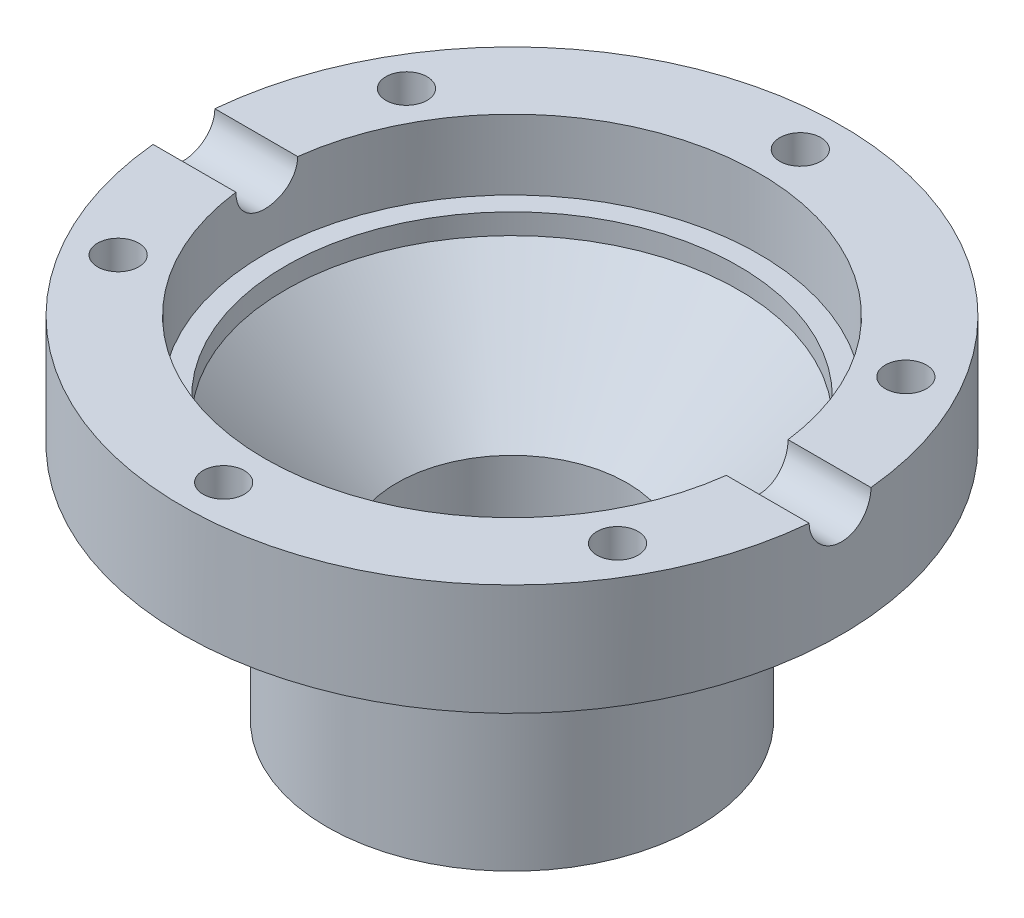
from build123d import *

# Parameters (mm, degrees)
SKETCH1_R           = 20.32
BOSS_EXTRUDE1_DEPTH = 21.59
SKETCH2_W           = 15.24
SKETCH2_H           = 4.318
SKETCH3_W           = 5.08
SKETCH3_H           = 14.732
CUT_EXTRUDE1_REACH  = 37.943
SKETCH4_R           = 1.27
CIRPATTERN1_COUNT   = 6
CUT_EXTRUDE2_REACH  = 37.943
SKETCH5_R           = 7.09676
SKETCH9_R           = 1.905
CUT_EXTRUDE3_DEPTH  = 51.305467894


with BuildPart() as part:
    # Sketch1 → Boss-Extrude1 (new body)
    with BuildSketch(Plane(origin=(0, 0, 0), x_dir=(1, 0, 0), z_dir=(0, 1, 0))):
        Circle(SKETCH1_R)
    extrude(amount=BOSS_EXTRUDE1_DEPTH)

    # Sketch2 → Cut-Revolve1 (revolve, cut)
    with BuildSketch(Plane.XY):
        with Locations((-7.62, 19.431)):
            Rectangle(SKETCH2_W, SKETCH2_H)
    revolve(axis=Axis((0, 55, 0), (0, -1, 0)), mode=Mode.SUBTRACT)

    # Sketch3 → Cut-Revolve2 (revolve, cut)
    with BuildSketch(Plane.XY):
        with Locations((-17.78, 7.366)):
            Rectangle(SKETCH3_W, SKETCH3_H)
    revolve(axis=Axis((0, 55, 0), (0, -1, 0)), mode=Mode.SUBTRACT)

    # Sketch4 → Cut-Extrude1 (cut, up to next)
    with BuildSketch(Plane(origin=(0, 21.59, 0), x_dir=(1, 0, 0), z_dir=(0, 1, 0)), mode=Mode.PRIVATE) as cut_extrude1_sk1:
        with Locations((0, 17.78)):
            Circle(SKETCH4_R)
    cut_extrude1_tool1 = extrude(cut_extrude1_sk1.sketch, amount=-CUT_EXTRUDE1_REACH, mode=Mode.PRIVATE) & part.part
    cut_extrude1 = cut_extrude1_tool1.solids().sort_by_distance((0, 21.59, -17.78))[0]
    add(cut_extrude1, mode=Mode.SUBTRACT)

    # CirPattern1: Cut-Extrude1 ×6 about axis
    cirpattern1_axis = Axis((0, 55, 0), (0, -1, 0))
    for i in range(1, CIRPATTERN1_COUNT):
        add(cut_extrude1.rotate(cirpattern1_axis, i * 360 / CIRPATTERN1_COUNT), mode=Mode.SUBTRACT)

    # Sketch5 → Cut-Extrude2 (cut, up to next)
    with BuildSketch(Plane.XZ, mode=Mode.PRIVATE) as cut_extrude2_sk1:
        Circle(SKETCH5_R)
    cut_extrude2_tool1 = extrude(cut_extrude2_sk1.sketch, amount=-CUT_EXTRUDE2_REACH, mode=Mode.PRIVATE) & part.part
    add(cut_extrude2_tool1.solids().sort_by_distance((0, 0, 0))[0], mode=Mode.SUBTRACT)

    # Sketch7 → Cut-Revolve3 (revolve, cut)
    with BuildSketch(Plane.XY):
        Polygon((-15.24, 14.732), (-11.40968, 10.90168), (-11.40968, 0), (-15.24, 0), align=None)
    revolve(axis=Axis((0, 55, 0), (0, -1, 0)), mode=Mode.SUBTRACT)

    # Sketch8 → Cut-Revolve4 (revolve, cut)
    with BuildSketch(Plane.XY):
        Polygon((-4.699, 17.272), (-13.97, 17.272), (-13.97, 16.002), (-4.699, 6.731), align=None)
    revolve(axis=Axis((0, 55, 0), (0, -1, 0)), mode=Mode.SUBTRACT)

    # Sketch9 → Cut-Extrude3 (cut, through all)
    with BuildSketch(Plane(origin=(20.32, 0, 0), x_dir=(0, 0, -1), z_dir=(1, 0, 0))):
        with Locations((0, 21.59)):
            Circle(SKETCH9_R)
    extrude(amount=-CUT_EXTRUDE3_DEPTH, mode=Mode.SUBTRACT)


solid = part.part
